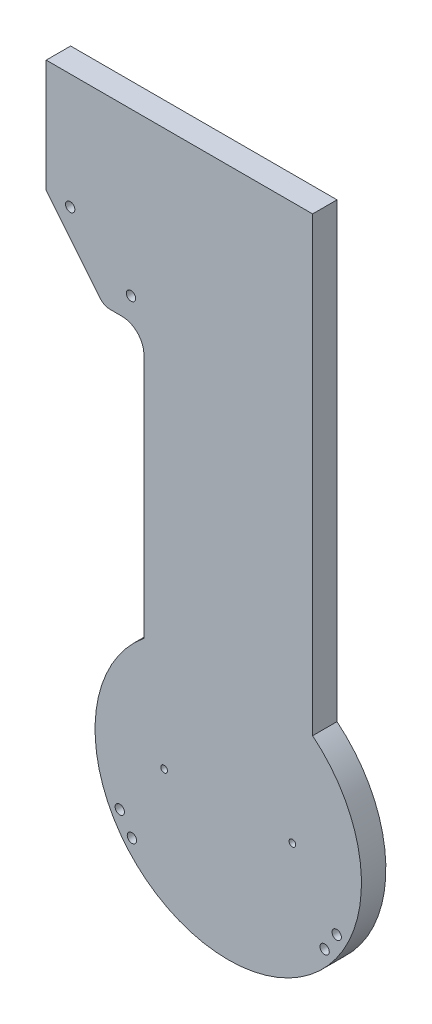
from build123d import *

# Parameters (mm, degrees)
EXTRUDE_1_DEPTH     = 5.5
FILLET_2_R          = 5
SKETCH_5_R          = 0.75
CUT_EXTRUDE_3_DEPTH = 132.667194092
SKETCH_6_R          = 1.05
CUT_EXTRUDE_4_DEPTH = 132.667194092
SKETCH_7_R          = 1.05
CUT_EXTRUDE_5_DEPTH = 132.667194092
FILLET_3_R          = 3


with BuildPart() as part:
    # ｽｹｯﾁ1 → ﾎﾞｽ - 押し出し1 (new body)
    with BuildSketch(Plane.XY):
        with BuildLine():
            Line((19, 125), (-41, 125))
            Line((-41, 125), (-41, 99.565085412))
            Line((-41, 99.565085412), (-28, 83.565085412))
            Line((-28, 83.565085412), (-19, 83.565085412))
            Line((-19, 83.565085412), (-19, 23.216373532))
            ThreePointArc((-19, 23.216373532), (0, -30), (19, 23.216373532))
            Line((19, 23.216373532), (19, 125))
        make_face()
    extrude(amount=EXTRUDE_1_DEPTH)

    # ﾌｨﾚｯﾄ2
    fillet_2_edges = [part.edges().sort_by_distance(p)[0] for p in [
        (-19, 83.565085412, 2.75),
    ]]
    fillet(fillet_2_edges, radius=FILLET_2_R)

    # ｽｹｯﾁ5 → ｶｯﾄ - 押し出し3 (cut, through all)
    with BuildSketch(Plane.XY.offset(5.5)):
        with Locations((14.45, 0)):
            Circle(SKETCH_5_R)
        with Locations((-14.45, 0)):
            Circle(SKETCH_5_R)
    extrude(amount=-CUT_EXTRUDE_3_DEPTH, mode=Mode.SUBTRACT)

    # ｽｹｯﾁ6 → ｶｯﾄ - 押し出し4 (cut, through all)
    with BuildSketch(Plane.XY.offset(5.5)):
        with Locations((-24.425038206, -12.880897043)):
            Circle(SKETCH_6_R)
        with Locations((-21.701843031, -17.074249883)):
            Circle(SKETCH_6_R)
        with Locations((24.425038206, -12.880897043)):
            Circle(SKETCH_6_R)
        with Locations((21.701843031, -17.074249883)):
            Circle(SKETCH_6_R)
    extrude(amount=-CUT_EXTRUDE_4_DEPTH, mode=Mode.SUBTRACT)

    # ｽｹｯﾁ7 → ｶｯﾄ - 押し出し5 (cut, through all)
    with BuildSketch(Plane.XY.offset(5.5)):
        with Locations((-21.9, 88.565085412)):
            Circle(SKETCH_7_R)
        with Locations((-35.6, 99.065085412)):
            Circle(SKETCH_7_R)
    extrude(amount=-CUT_EXTRUDE_5_DEPTH, mode=Mode.SUBTRACT)

    # ﾌｨﾚｯﾄ3
    fillet_3_edges = [part.edges().sort_by_distance(p)[0] for p in [
        (-28, 83.565085412, 2.75),
    ]]
    fillet(fillet_3_edges, radius=FILLET_3_R)


solid = part.part
